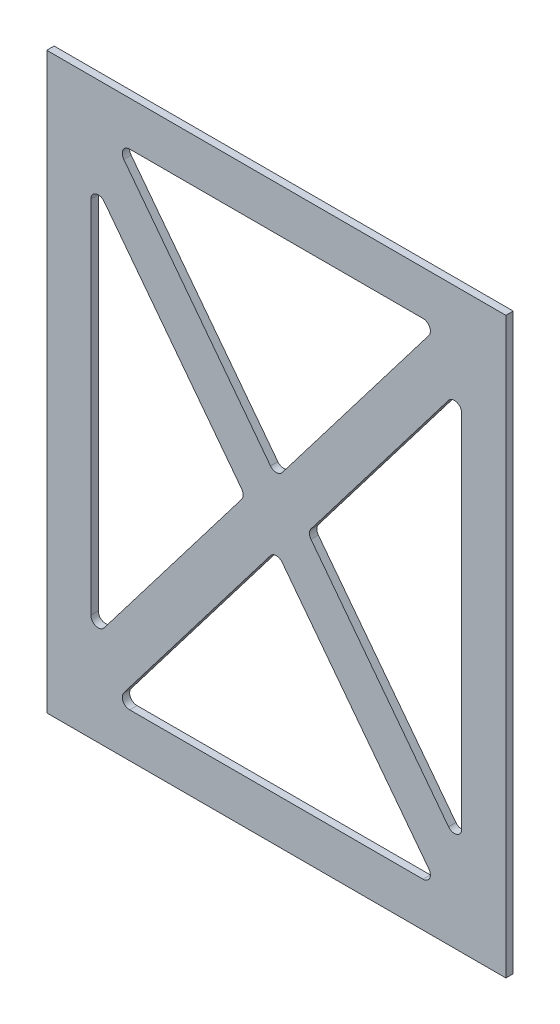
from build123d import *

# Parameters (mm, degrees)
SKETCH1_W           = 198.12
SKETCH1_H           = 247.65
BOSS_EXTRUDE1_DEPTH = 3.175
CUT_EXTRUDE1_REACH  = 160.605
FILLET1_R           = 3.175


with BuildPart() as part:
    # Sketch1 → Boss-Extrude1 (new body)
    with BuildSketch(Plane.XY):
        Rectangle(SKETCH1_W, SKETCH1_H)
    extrude(amount=BOSS_EXTRUDE1_DEPTH)

    # Sketch2 → Cut-Extrude1 (cut, up to next)
    with BuildSketch(Plane.XY.offset(3.175), mode=Mode.PRIVATE) as cut_extrude1_sk1:
        Polygon((-69.723524807, 104.775), (0, 13.470384182), (69.723524807, 104.775), align=None)
    cut_extrude1_tool1 = extrude(cut_extrude1_sk1.sketch, amount=-CUT_EXTRUDE1_REACH, mode=Mode.PRIVATE) & part.part
    # Sketch2 → Cut-Extrude1 (cut, up to next)
    with BuildSketch(Plane.XY.offset(3.175), mode=Mode.PRIVATE) as cut_extrude1_sk2:
        Polygon((-80.01, -87.135211191), (-13.470384182, 0), (-80.01, 87.135211191), align=None)
    cut_extrude1_tool2 = extrude(cut_extrude1_sk2.sketch, amount=-CUT_EXTRUDE1_REACH, mode=Mode.PRIVATE) & part.part
    # Sketch2 → Cut-Extrude1 (cut, up to next)
    with BuildSketch(Plane.XY.offset(3.175), mode=Mode.PRIVATE) as cut_extrude1_sk3:
        Polygon((80.01, 87.135211191), (13.470384182, 0), (80.01, -87.135211191), align=None)
    cut_extrude1_tool3 = extrude(cut_extrude1_sk3.sketch, amount=-CUT_EXTRUDE1_REACH, mode=Mode.PRIVATE) & part.part
    # Sketch2 → Cut-Extrude1 (cut, up to next)
    with BuildSketch(Plane.XY.offset(3.175), mode=Mode.PRIVATE) as cut_extrude1_sk4:
        Polygon((69.723524807, -104.775), (0, -13.470384182), (-69.723524807, -104.775), align=None)
    cut_extrude1_tool4 = extrude(cut_extrude1_sk4.sketch, amount=-CUT_EXTRUDE1_REACH, mode=Mode.PRIVATE) & part.part
    add(cut_extrude1_tool1.solids().sort_by_distance((0, 74.340128, 3.175))[0], mode=Mode.SUBTRACT)
    add(cut_extrude1_tool2.solids().sort_by_distance((-57.830128, 0, 3.175))[0], mode=Mode.SUBTRACT)
    add(cut_extrude1_tool3.solids().sort_by_distance((57.830128, 0, 3.175))[0], mode=Mode.SUBTRACT)
    add(cut_extrude1_tool4.solids().sort_by_distance((0, -74.340128, 3.175))[0], mode=Mode.SUBTRACT)

    # Fillet1
    fillet1_edges = [part.edges().sort_by_distance(p)[0] for p in [
        (80.01, -87.135211191, 1.5875),
        (69.723524807, -104.775, 1.5875),
        (-69.723524807, -104.775, 1.5875),
        (-80.01, -87.135211191, 1.5875),
        (-80.01, 87.135211191, 1.5875),
        (13.470384182, 0, 1.5875),
        (0, -13.470384182, 1.5875),
        (-13.470384182, 0, 1.5875),
        (0, 13.470384182, 1.5875),
        (69.723524807, 104.775, 1.5875),
        (80.01, 87.135211191, 1.5875),
        (-69.723524807, 104.775, 1.5875),
    ]]
    fillet(fillet1_edges, radius=FILLET1_R)


solid = part.part
